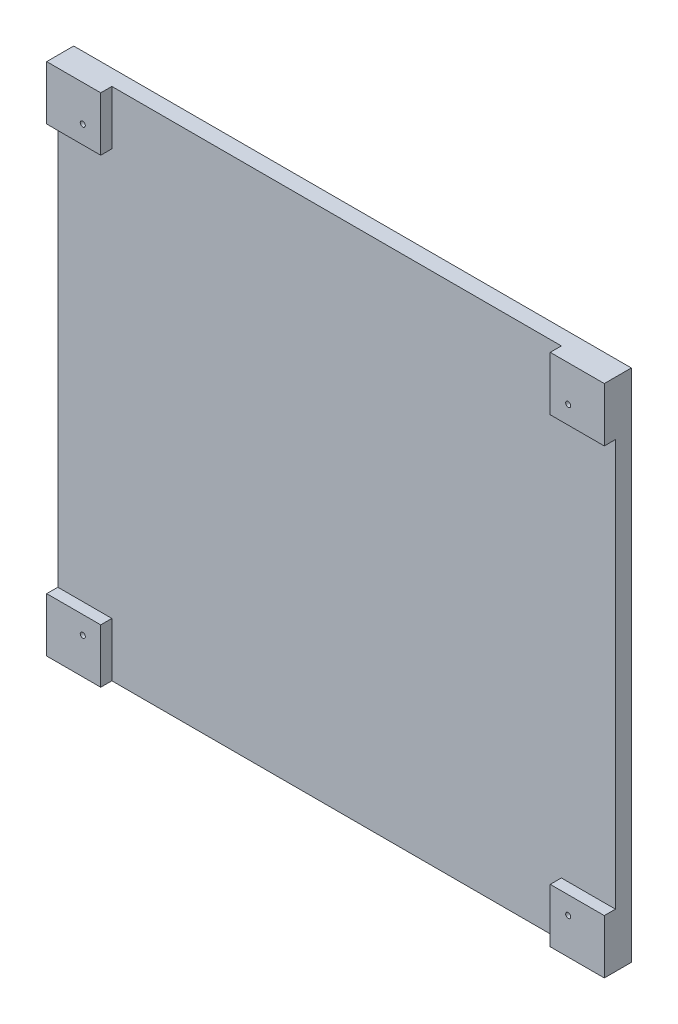
from build123d import *

# Parameters (mm, degrees)
SKETCH1_W           = 161.892
SKETCH1_H           = 175.354
BOSS_EXTRUDE1_DEPTH = 5
SKETCH2_W           = 17
SKETCH2_H           = 17
BOSS_EXTRUDE2_DEPTH = 3.5
SKETCH3_R           = 0.8
CUT_EXTRUDE1_DEPTH  = 120.63177356


with BuildPart() as part:
    # Sketch1 → Boss-Extrude1 (new body)
    with BuildSketch(Plane(origin=(0, 0, 0), x_dir=(0, 1, 0), z_dir=(0, 0, 1))):
        Rectangle(SKETCH1_W, SKETCH1_H)
    extrude(amount=BOSS_EXTRUDE1_DEPTH)

    # Sketch2 → Boss-Extrude2 (add)
    with BuildSketch(Plane.XY.offset(5)):
        with Locations((79.177, 72.446)):
            Rectangle(SKETCH2_W, SKETCH2_H)
        with Locations((-79.177, 72.446)):
            Rectangle(SKETCH2_W, SKETCH2_H)
        with Locations((79.177, -72.446)):
            Rectangle(SKETCH2_W, SKETCH2_H)
        with Locations((-79.177, -72.446)):
            Rectangle(SKETCH2_W, SKETCH2_H)
    extrude(amount=BOSS_EXTRUDE2_DEPTH)

    # Sketch3 → Cut-Extrude1 (cut, through all)
    with BuildSketch(Plane.XY.offset(8.5)):
        with Locations((-76.327, 69.596)):
            Circle(SKETCH3_R)
        with Locations((-76.327, -69.596)):
            Circle(SKETCH3_R)
        with Locations((76.327, -69.596)):
            Circle(SKETCH3_R)
        with Locations((76.327, 69.596)):
            Circle(SKETCH3_R)
    extrude(amount=-CUT_EXTRUDE1_DEPTH, mode=Mode.SUBTRACT)


solid = part.part
